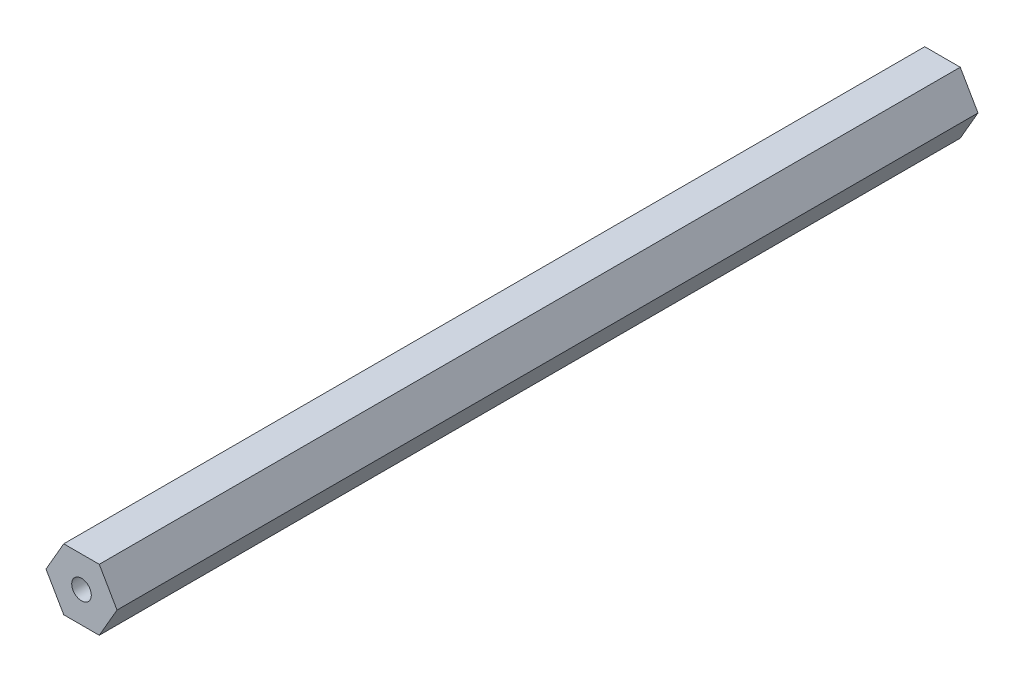
from build123d import *

# Parameters (mm, degrees)
BOSS_EXTRUDE1_DEPTH        = 177.8
F_10_32_TAPPED_HOLE1_D     = 4.0386
F_10_32_TAPPED_HOLE1_DEPTH = 76.2
F_10_32_TAPPED_HOLE1_TIP   = 1.213317848


with BuildPart() as part:
    # Sketch1 → Boss-Extrude1 (new body)
    with BuildSketch(Plane.XY):
        Polygon((7.332348419, 0), (3.666174209, 6.35), (-3.666174209, 6.35), (-7.332348419, 0), (-3.666174209, -6.35), (3.666174209, -6.35), align=None)
    extrude(amount=BOSS_EXTRUDE1_DEPTH)

    # #10-32 Tapped Hole1
    with Locations(Plane.XY.offset(177.8)):
        with Locations((0, 0)):
            Hole(F_10_32_TAPPED_HOLE1_D / 2, depth=F_10_32_TAPPED_HOLE1_DEPTH)
            with Locations((0, 0, -(F_10_32_TAPPED_HOLE1_DEPTH + F_10_32_TAPPED_HOLE1_TIP / 2))):  # 118° drill point
                Cone(0, F_10_32_TAPPED_HOLE1_D / 2, F_10_32_TAPPED_HOLE1_TIP, mode=Mode.SUBTRACT)


solid = part.part
